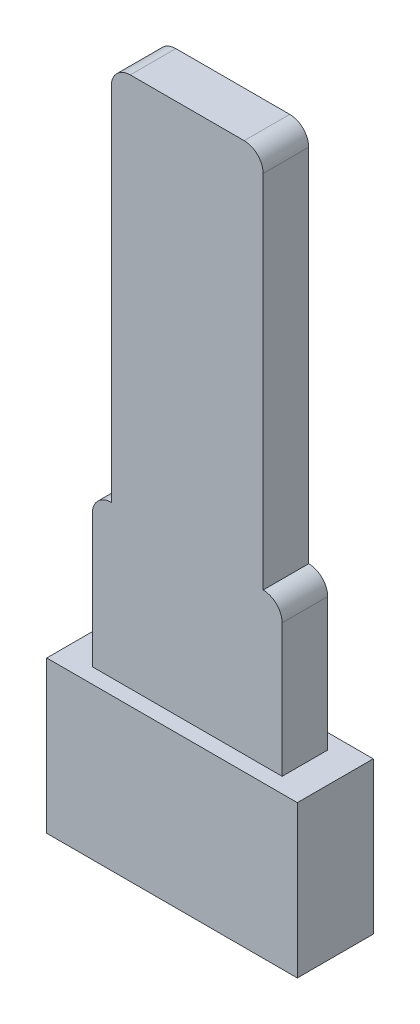
from build123d import *

# Parameters (mm, degrees)
SKETCH2_W           = 6.6
SKETCH2_H           = 2
BOSS_EXTRUDE1_DEPTH = 4
SKETCH3_W           = 5
SKETCH3_H           = 1.2
BOSS_EXTRUDE2_DEPTH = 4
SKETCH4_W           = 4
SKETCH4_H           = 1.2
BOSS_EXTRUDE3_DEPTH = 10
FILLET3_R           = 0.5


with BuildPart() as part:
    # Sketch2 → Boss-Extrude1 (new body)
    with BuildSketch(Plane(origin=(0, 0, 0), x_dir=(1, 0, 0), z_dir=(0, 1, 0))):
        Rectangle(SKETCH2_W, SKETCH2_H)
    extrude(amount=BOSS_EXTRUDE1_DEPTH)

    # Sketch3 → Boss-Extrude2 (add)
    with BuildSketch(Plane(origin=(0, 4, 0), x_dir=(1, 0, 0), z_dir=(0, 1, 0))):
        Rectangle(SKETCH3_W, SKETCH3_H)
    extrude(amount=BOSS_EXTRUDE2_DEPTH)

    # Sketch4 → Boss-Extrude3 (add)
    with BuildSketch(Plane(origin=(0, 8, 0), x_dir=(1, 0, 0), z_dir=(0, 1, 0))):
        Rectangle(SKETCH4_W, SKETCH4_H)
    extrude(amount=BOSS_EXTRUDE3_DEPTH)

    # Fillet3
    fillet3_edges = [part.edges().sort_by_distance(p)[0] for p in [
        (2.5, 8, 0),
        (-2.5, 8, 0),
        (2, 18, 0),
        (-2, 18, 0),
    ]]
    fillet(fillet3_edges, radius=FILLET3_R - 0.0001)  # a hair under: the kernel refuses the full size


solid = part.part
